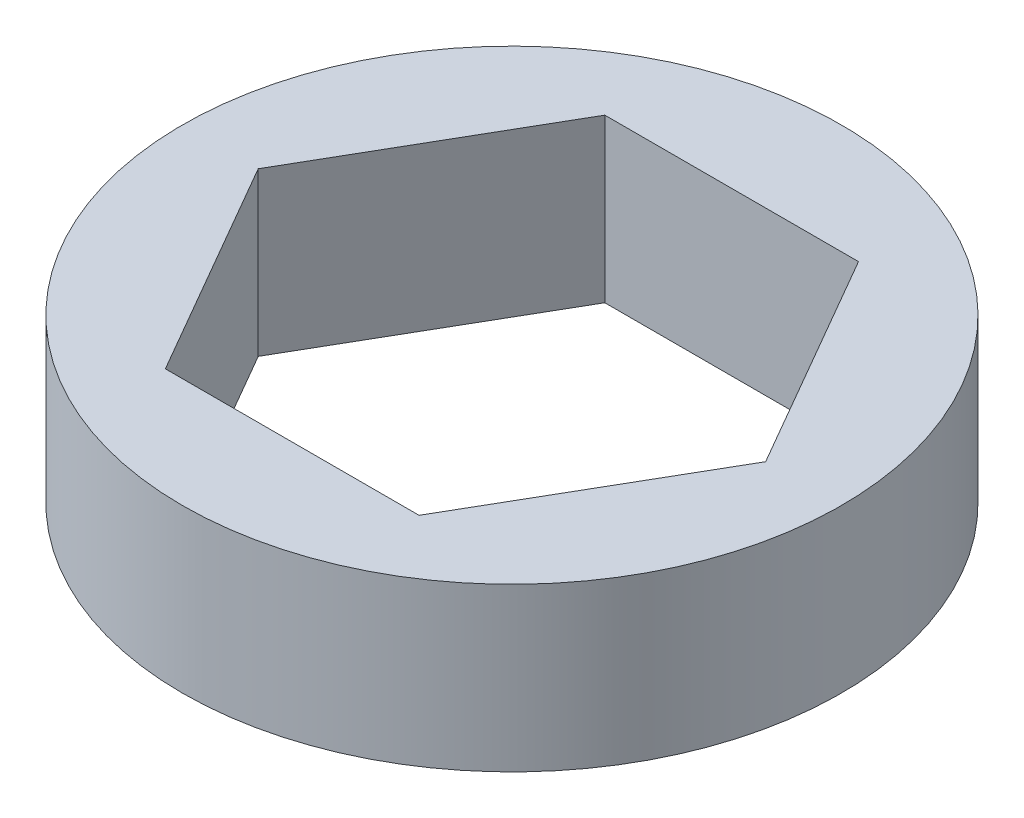
from build123d import *

# Parameters (mm, degrees)
SKETCH1_R           = 9.525
BOSS_EXTRUDE1_DEPTH = 4.69646


with BuildPart() as part:
    # Sketch1 → Boss-Extrude1 (new body)
    with BuildSketch(Plane(origin=(0, 0, 0), x_dir=(1, 0, 0), z_dir=(0, 1, 0))):
        Circle(SKETCH1_R)
        Polygon((7.332348419, 0), (3.666174209, 6.35), (-3.666174209, 6.35), (-7.332348419, 0), (-3.666174209, -6.35), (3.666174209, -6.35), align=None, mode=Mode.SUBTRACT)
    extrude(amount=BOSS_EXTRUDE1_DEPTH)


solid = part.part
